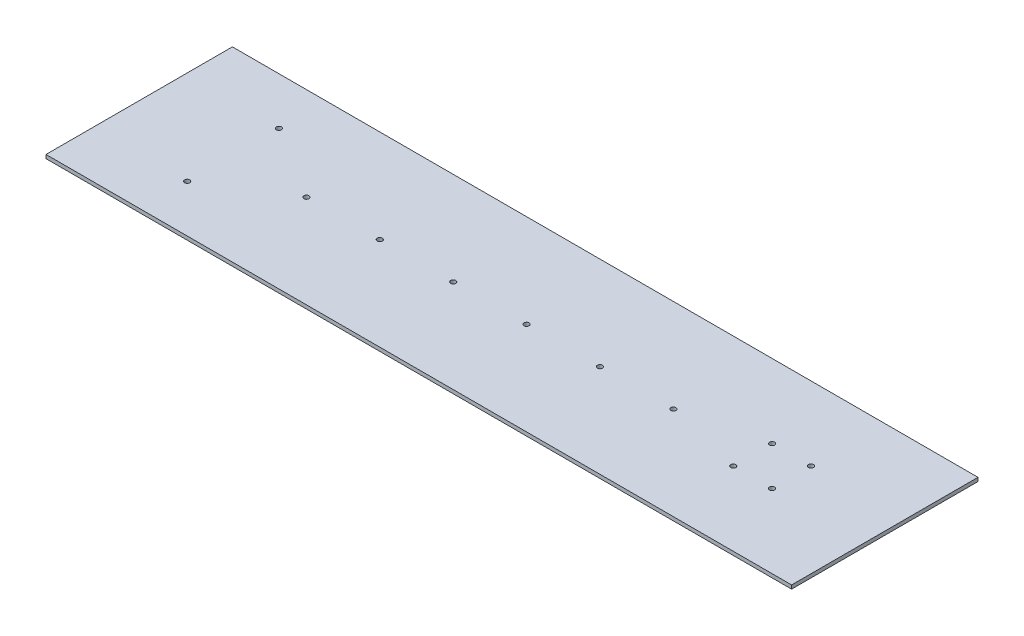
from build123d import *

# Parameters (mm, degrees)
SKETCH1_W             = 609.6
SKETCH1_H             = 152.4
BOSS_EXTRUDE1_DEPTH   = 3
M5X0_8_TAPPED_HOLE1_D = 4.2


with BuildPart() as part:
    # Sketch1 → Boss-Extrude1 (new body)
    with BuildSketch(Plane(origin=(0, 0, 0), x_dir=(1, 0, 0), z_dir=(0, 1, 0))):
        Rectangle(SKETCH1_W, SKETCH1_H)
    extrude(amount=BOSS_EXTRUDE1_DEPTH)

    # M5x0.8 Tapped Hole1 (through all)
    with Locations(Plane(origin=(0, 3, 0), x_dir=(1, 0, 0), z_dir=(0, 1, 0))):
        with Locations((228.5432, -15.875), (196.7932, -15.875), (196.7932, 15.875), (228.5432, 15.875), (131.9318, 0), (71.9318, 0), (11.9318, 0), (-48.0682, 0), (-108.0682, 0), (-168.0682, 0), (-228.0682, -37.5), (-228.0682, 37.5)):
            Hole(M5X0_8_TAPPED_HOLE1_D / 2)


solid = part.part
